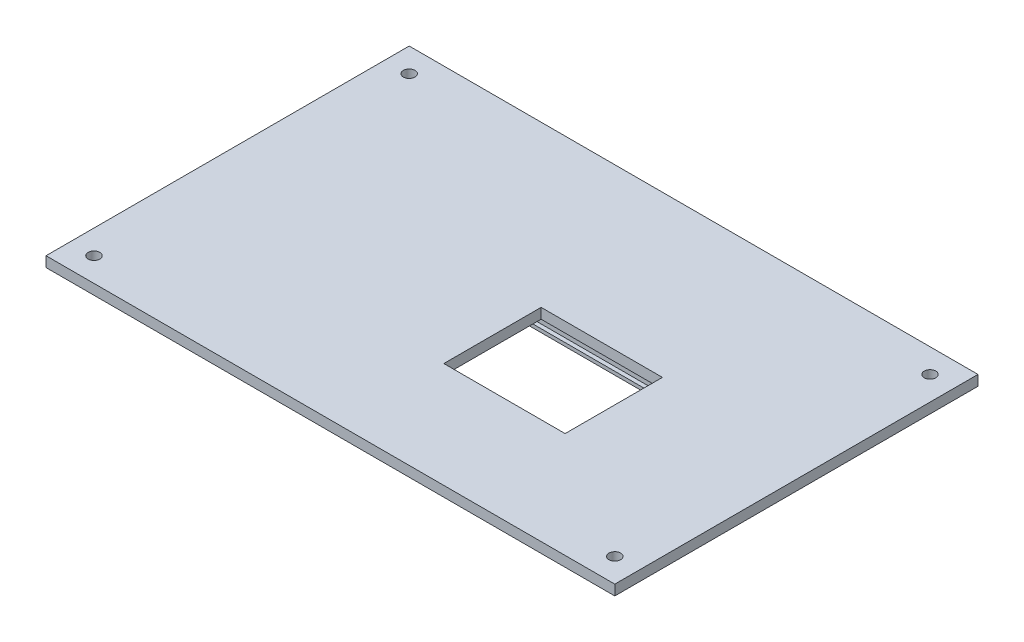
from build123d import *

# Parameters (mm, degrees)
LID_PLATE_START               = 88
SKETCH1_W                     = 166
SKETCH1_H                     = 106
LID_PLATE_DEPTH               = 3
TFT_WINDOW_DEPTH              = 135.085793431
TFT_WINDOW_DEPTH_BACK         = 135.085793431
SKETCH2_W                     = 35.4
SKETCH2_H                     = 28.4
LID_SCREW_HOLES_M3_DEPTH      = 135.085793431
LID_SCREW_HOLES_M3_DEPTH_BACK = 135.085793431
SKETCH3_R                     = 1.7
TFT_RAILS_START               = 88
SKETCH4_W                     = 48
SKETCH4_H                     = 2
TFT_RAILS_DEPTH               = 5.8
TFT_RAIL_LIPS_START           = 83.2
SKETCH5_W                     = 48
SKETCH5_H                     = 1.2
TFT_RAIL_LIPS_DEPTH           = 1


with BuildPart() as part:
    # Sketch1 → Lid_Plate (new body)
    with BuildSketch(Plane(origin=(0, 0, 0), x_dir=(1, 0, 0), z_dir=(0, 1, 0)).offset(LID_PLATE_START)):
        Rectangle(SKETCH1_W, SKETCH1_H)
    extrude(amount=LID_PLATE_DEPTH)

    # Sketch2 → TFT_Window (cut, two sides: drawn at the far end of the back side and taken through both)
    with BuildSketch(Plane(origin=(0, 0, 0), x_dir=(1, 0, 0), z_dir=(0, 1, 0)).offset(-TFT_WINDOW_DEPTH_BACK)):
        with Locations((20, -8)):
            Rectangle(SKETCH2_W, SKETCH2_H)
    extrude(amount=TFT_WINDOW_DEPTH + TFT_WINDOW_DEPTH_BACK, mode=Mode.SUBTRACT)

    # Sketch3 → Lid_Screw_Holes_M3 (cut, two sides: drawn at the far end of the back side and taken through both)
    with BuildSketch(Plane(origin=(0, 0, 0), x_dir=(1, 0, 0), z_dir=(0, 1, 0)).offset(-LID_SCREW_HOLES_M3_DEPTH_BACK)):
        with Locations((-76, 46)):
            Circle(SKETCH3_R)
        with Locations((-76, -46)):
            Circle(SKETCH3_R)
        with Locations((76, 46)):
            Circle(SKETCH3_R)
        with Locations((76, -46)):
            Circle(SKETCH3_R)
    extrude(amount=LID_SCREW_HOLES_M3_DEPTH + LID_SCREW_HOLES_M3_DEPTH_BACK, mode=Mode.SUBTRACT)

    # Sketch4 → TFT_Rails (add)
    with BuildSketch(Plane(origin=(0, 0, 0), x_dir=(1, 0, 0), z_dir=(0, 1, 0)).offset(TFT_RAILS_START)):
        with Locations((20, 10.8)):
            Rectangle(SKETCH4_W, SKETCH4_H)
        with Locations((20, -26.8)):
            Rectangle(SKETCH4_W, SKETCH4_H)
    extrude(amount=-TFT_RAILS_DEPTH)

    # Sketch5 → TFT_Rail_Lips (add)
    with BuildSketch(Plane(origin=(0, 0, 0), x_dir=(1, 0, 0), z_dir=(0, 1, 0)).offset(TFT_RAIL_LIPS_START)):
        with Locations((20, 9.2)):
            Rectangle(SKETCH5_W, SKETCH5_H)
        with Locations((20, -25.2)):
            Rectangle(SKETCH5_W, SKETCH5_H)
    extrude(amount=-TFT_RAIL_LIPS_DEPTH)


solid = part.part
